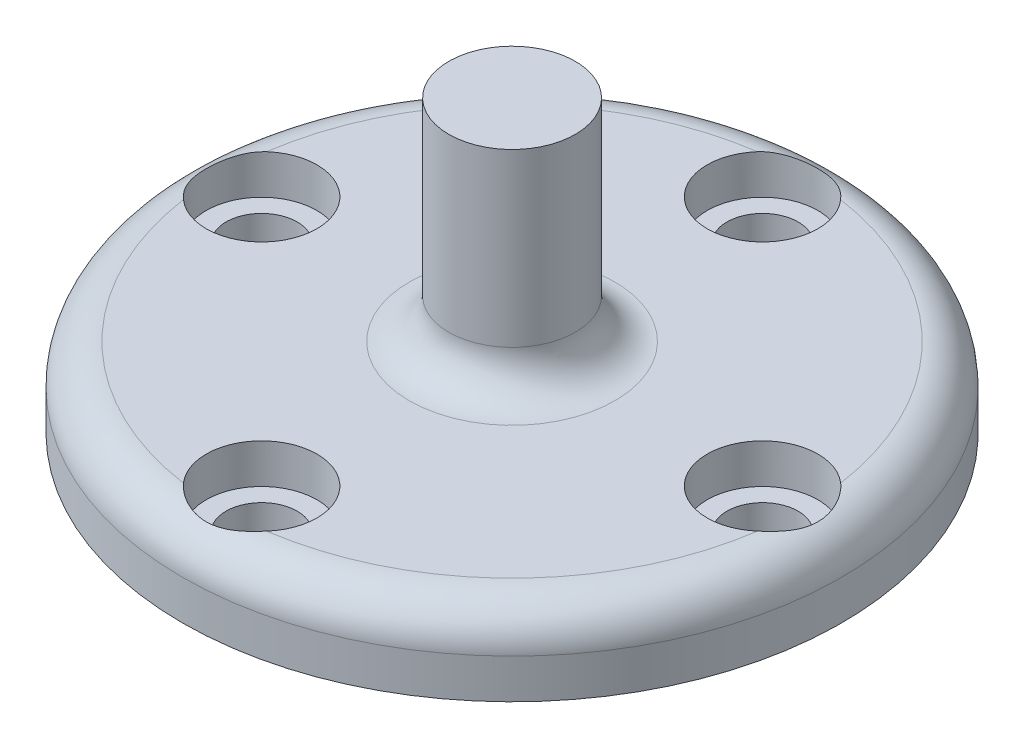
from build123d import *

# Parameters (mm, degrees)
SKETCH1_R           = 12.5
BOSS_EXTRUDE1_DEPTH = 3
SKETCH2_R           = 1.35
CUT_EXTRUDE1_DEPTH  = 18.930421077
SKETCH4_R           = 2.1
CUT_EXTRUDE2_DEPTH  = 1.5
CIRPATTERN1_COUNT   = 4
SKETCH3_R           = 2.4
BOSS_EXTRUDE2_DEPTH = 8
FILLET1_R           = 1.5


with BuildPart() as part:
    # Sketch1 → Boss-Extrude1 (new body)
    with BuildSketch(Plane(origin=(0, 0, 0), x_dir=(1, 0, 0), z_dir=(0, 1, 0))):
        with Locations(Location((0, 0, 0), (0, 0, 270))):
            Circle(SKETCH1_R)
    extrude(amount=BOSS_EXTRUDE1_DEPTH)

    # Sketch2 → Cut-Extrude1 (cut, through all)
    with BuildSketch(Plane(origin=(0, 3, 0), x_dir=(1, 0, 0), z_dir=(0, 1, 0))):
        with Locations(Location((0, 9.5, 0), (0, 0, 270))):
            Circle(SKETCH2_R)
    cut_extrude1 = extrude(amount=-CUT_EXTRUDE1_DEPTH, mode=Mode.SUBTRACT)

    # Sketch4 → Cut-Extrude2 (cut)
    with BuildSketch(Plane(origin=(0, 3, 0), x_dir=(1, 0, 0), z_dir=(0, 1, 0))):
        with Locations(Location((0, 9.5, 0), (0, 0, 270))):
            Circle(SKETCH4_R)
    cut_extrude2 = extrude(amount=-CUT_EXTRUDE2_DEPTH, mode=Mode.SUBTRACT)

    # CirPattern1: Cut-Extrude1, Cut-Extrude2 ×4 about axis
    cirpattern1_axis = Axis((0, 0, 0), (0, 1, 0))
    add([cut_extrude1.rotate(cirpattern1_axis, i * 360 / CIRPATTERN1_COUNT) for i in range(1, CIRPATTERN1_COUNT)], mode=Mode.SUBTRACT)
    add([cut_extrude2.rotate(cirpattern1_axis, i * 360 / CIRPATTERN1_COUNT) for i in range(1, CIRPATTERN1_COUNT)], mode=Mode.SUBTRACT)

    # Sketch3 → Boss-Extrude2 (add)
    with BuildSketch(Plane(origin=(0, 3, 0), x_dir=(1, 0, 0), z_dir=(0, 1, 0))):
        with Locations(Location((0, 0, 0), (0, 0, 270))):
            Circle(SKETCH3_R)
    extrude(amount=BOSS_EXTRUDE2_DEPTH)

    # Fillet1
    # the kernel refuses this fillet: 1.5 mm, written as the material it adds along each edge
    with BuildSketch(Plane(origin=(0, 3, 0), x_dir=(0, 0, 1), z_dir=(-1, 0, 0))) as fillet1_piece_1:
        with BuildLine():
            CenterArc((2.4 + FILLET1_R, FILLET1_R), FILLET1_R, 180, 90)
            Line((2.4, FILLET1_R), (2.4, 0))
            Line((2.4, 0), (2.4 + FILLET1_R, 0))
        make_face()
    revolve(axis=Axis((0, 3, 0), (0, 1, 0)))
    # the kernel refuses this fillet: 1.5 mm, written as the material it takes off along each edge
    with BuildSketch(Plane(origin=(0, 3, 0), x_dir=(0, 0, 1), z_dir=(-1, 0, 0))) as fillet1_2_piece_1:
        with BuildLine():
            CenterArc((12.5 - FILLET1_R, -FILLET1_R), FILLET1_R, 0, 90)
            Line((12.5 - FILLET1_R, 0), (12.5, 0))
            Line((12.5, 0), (12.5, -FILLET1_R))
        make_face()
    revolve(axis=Axis((0, 3, 0), (0, 1, 0)), mode=Mode.SUBTRACT)


solid = part.part
